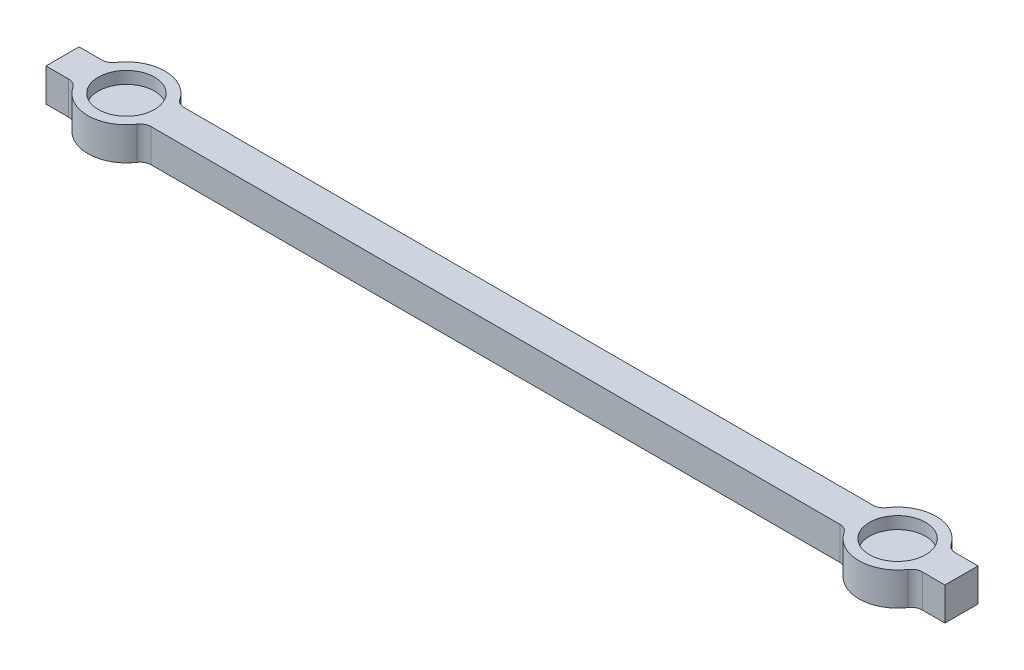
from build123d import *

# Parameters (mm, degrees)
SKETCH1_R          = 3.5
SKETCH1_W          = 81.6
SKETCH1_H          = 3
BASE_SHAPE_DEPTH   = 3
SKETCH2_R          = 2.55
MAGNET_HOLES_DEPTH = 1.1
FILLET1_R          = 1


with BuildPart() as part:
    # Sketch1 → Base shape (new body)
    with BuildSketch(Plane(origin=(0, 0, 0), x_dir=(1, 0, 0), z_dir=(0, 1, 0))):
        with Locations((-35, 0)):
            Circle(SKETCH1_R)
        with Locations((35, 0)):
            Circle(SKETCH1_R)
        Rectangle(SKETCH1_W, SKETCH1_H)
    extrude(amount=BASE_SHAPE_DEPTH)

    # Sketch2 → Magnet holes (cut)
    with BuildSketch(Plane(origin=(0, 3, 0), x_dir=(1, 0, 0), z_dir=(0, 1, 0))):
        with Locations((-35, 0)):
            Circle(SKETCH2_R)
        with Locations((35, 0)):
            Circle(SKETCH2_R)
    extrude(amount=-MAGNET_HOLES_DEPTH, mode=Mode.SUBTRACT)

    # Fillet1
    fillet1_edges = [part.edges().sort_by_distance(p)[0] for p in [
        (31.83772234, 1.5, -1.5),
        (-38.16227766, 1.5, -1.5),
        (-31.83772234, 1.5, -1.5),
        (38.16227766, 1.5, -1.5),
        (38.16227766, 1.5, 1.5),
        (31.83772234, 1.5, 1.5),
        (-31.83772234, 1.5, 1.5),
        (-38.16227766, 1.5, 1.5),
    ]]
    fillet(fillet1_edges, radius=FILLET1_R)


solid = part.part
